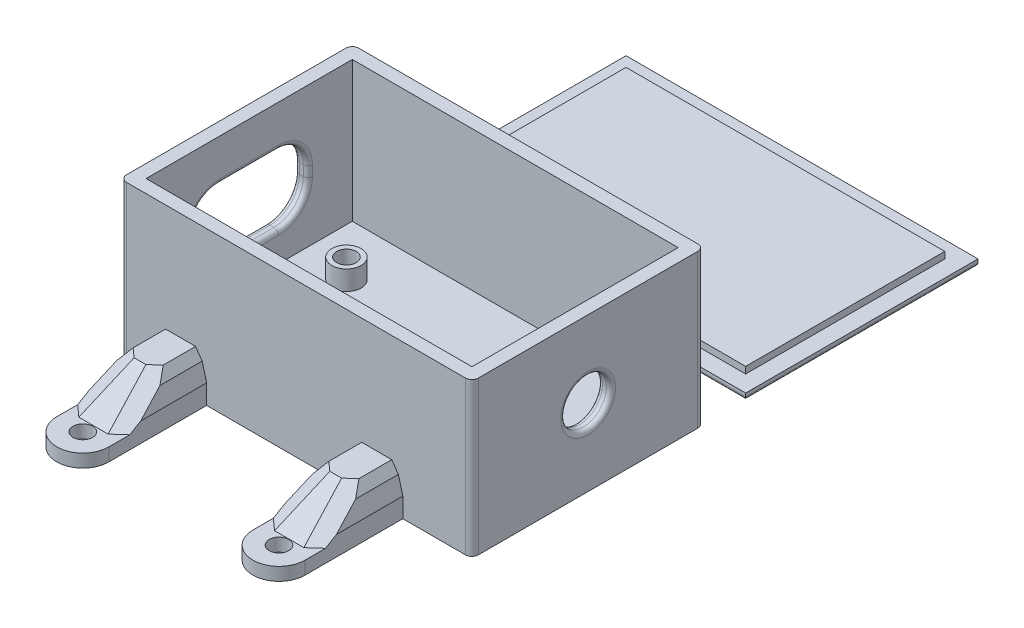
from build123d import *
from OCP.BRepFilletAPI import BRepFilletAPI_MakeChamfer

# Parameters (mm, degrees)
CROQUIS1_W              = 50
CROQUIS1_H              = 31.65
CROQUIS1_R              = 1.5
SALIENTE_EXTRUIR1_DEPTH = 2
CROQUIS2_W              = 54
CROQUIS2_H              = 35.65
CROQUIS2_W_2            = 50
CROQUIS2_H_2            = 31.65
SALIENTE_EXTRUIR2_DEPTH = 23.5
CROQUIS3_R              = 2.25
CROQUIS3_R_2            = 1.5
SALIENTE_EXTRUIR3_DEPTH = 3
CORTAR_EXTRUIR1_DEPTH   = 3
CROQUIS5_R              = 3.5
CORTAR_EXTRUIR2_DEPTH   = 3
REDONDEO2_R             = 0.7
CROQUIS6_R              = 1.5
SALIENTE_EXTRUIR4_DEPTH = 2
CROQUIS7_W              = 8
CROQUIS7_H              = 13.434758297
CROQUIS7_H_2            = 13.360050844
SALIENTE_EXTRUIR5_DEPTH = 5
CHAFL_N1_SIZE           = 4
CHAFL_N1_SIZE2          = 1.07179677
CHAFL_N2_SIZE           = 7.140740034
CHAFL_N2_SIZE_2         = 5
CHAFL_N3_SIZE           = 2
CHAFL_N3_SIZE_2         = 1.061715873
REDONDEO3_R             = 0.7
CROQUIS10_W             = 54
CROQUIS10_H             = 35.65
SALIENTE_EXTRUIR8_DEPTH = 1
CROQUIS11_W             = 49
CROQUIS11_H             = 30.65
SALIENTE_EXTRUIR9_DEPTH = 1
REDONDEO4_R             = 1
CHAFL_N4_SIZE           = 3
CHAFL_N4_SIZE_2         = 0.05
REDONDEO5_R             = 0.5
CHAFL_N6_SIZE           = 1.5
CHAFL_N6_SIZE2          = 0.62629425


# Some blends are built 0.0001 mm under size
with BuildPart() as part:
    # Croquis1 → Saliente-Extruir1 (new body)
    with BuildSketch(Plane(origin=(0, 0, 0), x_dir=(1, 0, 0), z_dir=(0, 1, 0))):
        with Locations((25, 15.825)):
            Rectangle(CROQUIS1_W, CROQUIS1_H)
        with Locations(Location((7.3, 23.45, 0), (0, 0, 270))):
            Circle(CROQUIS1_R, mode=Mode.SUBTRACT)
        with Locations(Location((37.4, 8.05, 0), (0, 0, 270))):
            Circle(CROQUIS1_R, mode=Mode.SUBTRACT)
    extrude(amount=SALIENTE_EXTRUIR1_DEPTH)

    # Croquis2 → Saliente-Extruir2 (add)
    with BuildSketch(Plane.XZ):
        with Locations((25, -15.825)):
            Rectangle(CROQUIS2_W, CROQUIS2_H)
        with Locations((25, -15.825)):
            Rectangle(CROQUIS2_W_2, CROQUIS2_H_2, mode=Mode.SUBTRACT)
    extrude(amount=-SALIENTE_EXTRUIR2_DEPTH)

    # Croquis3 → Saliente-Extruir3 (add)
    # profile 1 of 2: a face of its own
    with BuildSketch(Plane(origin=(0, 2, 0), x_dir=(1, 0, 0), z_dir=(0, 1, 0))):
        with Locations(Location((7.3, 23.45, 0), (0, 0, 90))):
            Circle(CROQUIS3_R)
        with Locations(Location((7.3, 23.45, 0), (0, 0, 270))):
            Circle(CROQUIS3_R_2, mode=Mode.SUBTRACT)
    # profile 2 of 2: a face of its own
    with BuildSketch(Plane(origin=(0, 2, 0), x_dir=(1, 0, 0), z_dir=(0, 1, 0))):
        with Locations(Location((37.4, 8.05, 0), (0, 0, 90))):
            Circle(CROQUIS3_R)
        with Locations(Location((37.4, 8.05, 0), (0, 0, 270))):
            Circle(CROQUIS3_R_2, mode=Mode.SUBTRACT)
    extrude(amount=SALIENTE_EXTRUIR3_DEPTH)

    # Croquis4 → Cortar-Extruir1 (cut)
    with BuildSketch(Plane.ZY.offset(2)):
        with BuildLine():
            Line((-20.325, 17.075), (-11.325, 17.075))
            ThreePointArc((-11.325, 17.075), (-8.143019485, 15.756980515), (-6.825, 12.575))
            Line((-6.825, 12.575), (-6.825, 11))
            ThreePointArc((-6.825, 11), (-8.143019485, 7.818019485), (-11.325, 6.5))
            Line((-11.325, 6.5), (-20.325, 6.5))
            ThreePointArc((-20.325, 6.5), (-23.506980515, 7.818019485), (-24.825, 11))
            Line((-24.825, 11), (-24.825, 12.575))
            ThreePointArc((-24.825, 12.575), (-23.506980515, 15.756980515), (-20.325, 17.075))
        make_face()
    extrude(amount=-CORTAR_EXTRUIR1_DEPTH, mode=Mode.SUBTRACT)

    # Croquis5 → Cortar-Extruir2 (cut)
    with BuildSketch(Plane(origin=(52, 0, 0), x_dir=(0, 0, -1), z_dir=(1, 0, 0))):
        with Locations((15.825, 11.75)):
            Circle(CROQUIS5_R)
    extrude(amount=-CORTAR_EXTRUIR2_DEPTH, mode=Mode.SUBTRACT)

    # Redondeo2
    redondeo2_edges = [part.edges().sort_by_distance(p)[0] for p in [
        (0, 7.818019485, -23.506980515),
        (0, 11.7875, -24.825),
        (0, 15.756980515, -23.506980515),
        (0, 17.075, -15.825),
        (0, 15.756980515, -8.143019485),
        (0, 11.7875, -6.825),
        (0, 7.818019485, -8.143019485),
        (0, 6.5, -15.825),
        (-2, 7.818019485, -23.506980515),
        (-2, 6.5, -15.825),
        (-2, 7.818019485, -8.143019485),
        (-2, 11.7875, -6.825),
        (-2, 15.756980515, -8.143019485),
        (-2, 17.075, -15.825),
        (-2, 15.756980515, -23.506980515),
        (-2, 11.7875, -24.825),
    ]]
    fillet(redondeo2_edges, radius=REDONDEO2_R)

    # Croquis6 → Saliente-Extruir4 (add)
    # profile 1 of 2: a face of its own
    with BuildSketch(Plane(origin=(0, 0, 0), x_dir=(-1, 0, 0), z_dir=(0, -1, 0))):
        with BuildLine():
            Line((-33.4, -2), (-33.4, -17))
            ThreePointArc((-33.4, -17), (-37.4, -21), (-41.4, -17))
            Line((-41.4, -17), (-41.4, -2))
            Line((-41.4, -2), (-33.4, -2))
        make_face()
        with Locations(Location((-37.4, -17, 0), (0, 0, 90))):
            Circle(CROQUIS6_R, mode=Mode.SUBTRACT)
    # profile 2 of 2: a face of its own
    with BuildSketch(Plane(origin=(0, 0, 0), x_dir=(-1, 0, 0), z_dir=(0, -1, 0))):
        with BuildLine():
            Line((-3.3, -2), (-3.3, -17))
            ThreePointArc((-3.3, -17), (-7.3, -21), (-11.3, -17))
            Line((-11.3, -17), (-11.3, -2))
            Line((-11.3, -2), (-3.3, -2))
        make_face()
        with Locations(Location((-7.3, -17, 0), (0, 0, 90))):
            Circle(CROQUIS6_R, mode=Mode.SUBTRACT)
    extrude(amount=-SALIENTE_EXTRUIR4_DEPTH)

    # Croquis7 → Saliente-Extruir5 (add)
    with BuildSketch(Plane(origin=(0, 2, 0), x_dir=(1, 0, 0), z_dir=(0, 1, 0))):
        with Locations((37.4, -8.717379149)):
            Rectangle(CROQUIS7_W, CROQUIS7_H)
        with Locations((7.3, -8.680025422)):
            Rectangle(CROQUIS7_W, CROQUIS7_H_2)
    extrude(amount=SALIENTE_EXTRUIR5_DEPTH)

    # Chaflán1: one chamfer whose edges measure the first distance from different faces: ONE call of the kernel's chamfer builder (chamfer() names one face for all edges)
    chafl_n1_edges_1 = [part.edges().sort_by_distance(p)[0] for p in [
        (33.4, 7, 8.717379148),
    ]]
    chafl_n1_side_1 = [part.faces().sort_by_distance(p)[0] for p in [
        (33.4, 3.419461736, 8.958993942),
    ]]
    chafl_n1_edges_2 = [part.edges().sort_by_distance(p)[0] for p in [
        (41.4, 7, 8.717379148),
    ]]
    chafl_n1_side_2 = [part.faces().sort_by_distance(p)[0] for p in [
        (41.4, 3.419461736, 8.958993942),
    ]]
    chafl_n1_edges_3 = [part.edges().sort_by_distance(p)[0] for p in [
        (11.3, 7, 8.680025422),
    ]]
    chafl_n1_side_3 = [part.faces().sort_by_distance(p)[0] for p in [
        (11.3, 3.415292105, 8.934149107),
    ]]
    chafl_n1_edges_4 = [part.edges().sort_by_distance(p)[0] for p in [
        (3.3, 7, 8.680025422),
    ]]
    chafl_n1_side_4 = [part.faces().sort_by_distance(p)[0] for p in [
        (3.3, 3.415292105, 8.934149107),
    ]]
    chafl_n1 = BRepFilletAPI_MakeChamfer(part.part.solid().wrapped)
    for e in chafl_n1_edges_1:
        chafl_n1.Add(CHAFL_N1_SIZE, CHAFL_N1_SIZE2, e.wrapped, chafl_n1_side_1[0].wrapped)  # the first distance lies on this face
    for e in chafl_n1_edges_2:
        chafl_n1.Add(CHAFL_N1_SIZE, CHAFL_N1_SIZE2, e.wrapped, chafl_n1_side_2[0].wrapped)  # the first distance lies on this face
    for e in chafl_n1_edges_3:
        chafl_n1.Add(CHAFL_N1_SIZE, CHAFL_N1_SIZE2, e.wrapped, chafl_n1_side_3[0].wrapped)  # the first distance lies on this face
    for e in chafl_n1_edges_4:
        chafl_n1.Add(CHAFL_N1_SIZE, CHAFL_N1_SIZE2, e.wrapped, chafl_n1_side_4[0].wrapped)  # the first distance lies on this face
    add(Compound.cast(chafl_n1.Shape()), mode=Mode.REPLACE)

    # Chaflán2
    chafl_n2_edges_1 = [part.edges().sort_by_distance(p)[0] for p in [
        (7.3, 7, 15.360050844),
    ]]
    chafl_n2_side_1 = [part.faces().sort_by_distance(p)[0] for p in [
        (7.3, 7, 15.260050844),
    ]]
    chafl_n2_edges_2 = [part.edges().sort_by_distance(p)[0] for p in [
        (37.4, 7, 15.434758297),
    ]]
    chafl_n2_side_2 = [part.faces().sort_by_distance(p)[0] for p in [
        (37.4, 7, 15.334758297),
    ]]
    chafl_n2 = BRepFilletAPI_MakeChamfer(part.part.solid().wrapped)
    for e in chafl_n2_edges_1:
        chafl_n2.Add(CHAFL_N2_SIZE - 0.0001, CHAFL_N2_SIZE_2 - 0.0001, e.wrapped, chafl_n2_side_1[0].wrapped)
    for e in chafl_n2_edges_2:
        chafl_n2.Add(CHAFL_N2_SIZE - 0.0001, CHAFL_N2_SIZE_2 - 0.0001, e.wrapped, chafl_n2_side_2[0].wrapped)
    add(Compound.cast(chafl_n2.Shape()), mode=Mode.REPLACE)  # a hair under: the kernel refuses the full size

    # Chaflán3
    # the kernel refuses this chamfer: 2, 1.061715873 mm, written as the material it takes off along each edge
    with BuildSketch(Plane(origin=(39.541038051, 9.937740445, 4.098564946), x_dir=(-0.9882635792671295, -0.07375593896843995, 0.13377279006212586), z_dir=(0.15190517787522226, -0.566917841763116, 0.8096474403253232))) as chafl_n3_piece_1_section:
        Polygon((CHAFL_N3_SIZE * 0.999866964113, CHAFL_N3_SIZE * 0.0163111641311), (-CHAFL_N3_SIZE_2 * 0.227924724336, CHAFL_N3_SIZE_2 * 0.973678756308), (0, 0), align=None)
    chafl_n3_piece_1 = extrude(amount=17.419597977, mode=Mode.PRIVATE)
    chafl_n3_piece_1 = split(chafl_n3_piece_1, bisect_by=Plane(origin=(40.297919966, 2, 11.036319087), z_dir=(0, 1, 0)), keep=Keep.TOP, mode=Mode.PRIVATE)
    add(chafl_n3_piece_1, mode=Mode.SUBTRACT)
    with BuildSketch(Plane(origin=(35.258961949, 9.937740445, 4.098564946), x_dir=(0.9882635792671295, -0.07375593896843995, 0.13377279006212586), z_dir=(-0.15190517787522226, -0.566917841763116, 0.8096474403253232))) as chafl_n3_piece_2_section:
        Polygon((CHAFL_N3_SIZE * 0.999866964113, -CHAFL_N3_SIZE * 0.0163111641311), (-CHAFL_N3_SIZE_2 * 0.227924724336, -CHAFL_N3_SIZE_2 * 0.973678756308), (0, 0), align=None)
    chafl_n3_piece_2 = extrude(amount=17.419597977, mode=Mode.PRIVATE)
    chafl_n3_piece_2 = split(chafl_n3_piece_2, bisect_by=Plane(origin=(34.502080034, 2, 11.036319122), z_dir=(0, 1, 0)), keep=Keep.TOP, mode=Mode.PRIVATE)
    add(chafl_n3_piece_2, mode=Mode.SUBTRACT)
    with BuildSketch(Plane(origin=(9.441038051, 9.937740445, 4.023857494), x_dir=(0.2645325925952416, -0.7659513941920656, -0.5859530435026945), z_dir=(0.15190517787522226, -0.566917841763116, 0.8096474403253232))) as chafl_n3_piece_3_section:
        Polygon((CHAFL_N3_SIZE_2 * 0.998358379547, -CHAFL_N3_SIZE_2 * 0.0572760546561), (-CHAFL_N3_SIZE * 0.267638518525, -CHAFL_N3_SIZE * 0.963519394409), (0, 0), align=None)
    chafl_n3_piece_3 = extrude(amount=17.419597977, mode=Mode.PRIVATE)
    chafl_n3_piece_3 = split(chafl_n3_piece_3, bisect_by=Plane(origin=(10.197993246, 2, 10.977264195), z_dir=(0, 1, 0)), keep=Keep.TOP, mode=Mode.PRIVATE)
    add(chafl_n3_piece_3, mode=Mode.SUBTRACT)
    with BuildSketch(Plane(origin=(5.158961949, 9.937740445, 4.023857494), x_dir=(-0.2645325925952419, -0.7659513941920656, -0.5859530435026947), z_dir=(-0.15190517787522234, -0.566917841763116, 0.8096474403253232))) as chafl_n3_piece_4_section:
        Polygon((CHAFL_N3_SIZE_2 * 0.998358379547, CHAFL_N3_SIZE_2 * 0.0572760546561), (-CHAFL_N3_SIZE * 0.267638518525, CHAFL_N3_SIZE * 0.963519394409), (0, 0), align=None)
    chafl_n3_piece_4 = extrude(amount=17.419597977, mode=Mode.PRIVATE)
    chafl_n3_piece_4 = split(chafl_n3_piece_4, bisect_by=Plane(origin=(4.402006753, 2, 10.977264231), z_dir=(0, 1, 0)), keep=Keep.TOP, mode=Mode.PRIVATE)
    add(chafl_n3_piece_4, mode=Mode.SUBTRACT)

    # Redondeo3
    redondeo3_edges = [part.edges().sort_by_distance(p)[0] for p in [
        (50, 11.75, -12.325),
        (52, 11.75, -12.325),
    ]]
    fillet(redondeo3_edges, radius=REDONDEO3_R)

    # Redondeo4
    redondeo4_edges = [part.edges().sort_by_distance(p)[0] for p in [
        (52, 11.75, 2),
        (52, 11.75, -33.65),
        (-2, 11.75, -33.65),
        (-2, 11.75, 2),
    ]]
    fillet(redondeo4_edges, radius=REDONDEO4_R)

    # Chaflán6: one chamfer whose edges measure the first distance from different faces: ONE call of the kernel's chamfer builder (chamfer() names one face for all edges)
    chafl_n6_edges_1 = [part.edges().sort_by_distance(p)[0] for p in [
        (34.47179677, 7, 4.242572884),
    ]]
    chafl_n6_side_1 = [part.faces().sort_by_distance(p)[0] for p in [
        (33.866398411, 4.740622568, 5.855945246),
    ]]
    chafl_n6_edges_2 = [part.edges().sort_by_distance(p)[0] for p in [
        (4.37179677, 7, 4.205219158),
    ]]
    chafl_n6_side_2 = [part.faces().sort_by_distance(p)[0] for p in [
        (3.765683901, 4.737955981, 5.820495672),
    ]]
    chafl_n6_edges_3 = [part.edges().sort_by_distance(p)[0] for p in [
        (40.32820323, 7, 4.242572884),
    ]]
    chafl_n6_side_3 = [part.faces().sort_by_distance(p)[0] for p in [
        (40.933601589, 4.740622568, 5.855945246),
    ]]
    chafl_n6_edges_4 = [part.edges().sort_by_distance(p)[0] for p in [
        (10.22820323, 7, 4.205219158),
    ]]
    chafl_n6_side_4 = [part.faces().sort_by_distance(p)[0] for p in [
        (10.834316099, 4.737955981, 5.820495672),
    ]]
    chafl_n6 = BRepFilletAPI_MakeChamfer(part.part.solid().wrapped)
    for e in chafl_n6_edges_1:
        chafl_n6.Add(CHAFL_N6_SIZE, CHAFL_N6_SIZE2, e.wrapped, chafl_n6_side_1[0].wrapped)  # the first distance lies on this face
    for e in chafl_n6_edges_2:
        chafl_n6.Add(CHAFL_N6_SIZE, CHAFL_N6_SIZE2, e.wrapped, chafl_n6_side_2[0].wrapped)  # the first distance lies on this face
    for e in chafl_n6_edges_3:
        chafl_n6.Add(CHAFL_N6_SIZE, CHAFL_N6_SIZE2, e.wrapped, chafl_n6_side_3[0].wrapped)  # the first distance lies on this face
    for e in chafl_n6_edges_4:
        chafl_n6.Add(CHAFL_N6_SIZE, CHAFL_N6_SIZE2, e.wrapped, chafl_n6_side_4[0].wrapped)  # the first distance lies on this face
    add(Compound.cast(chafl_n6.Shape()), mode=Mode.REPLACE)


with BuildPart() as body_2:
    # Croquis10 → Saliente-Extruir8 (new body)
    with BuildSketch(Plane.XZ):
        with Locations((25, -57.825)):
            Rectangle(CROQUIS10_W, CROQUIS10_H)
    extrude(amount=-SALIENTE_EXTRUIR8_DEPTH)

    # Croquis11 → Saliente-Extruir9 (add)
    with BuildSketch(Plane(origin=(0, 1, 0), x_dir=(1, 0, 0), z_dir=(0, 1, 0))):
        with Locations((25, 57.825)):
            Rectangle(CROQUIS11_W, CROQUIS11_H)
    extrude(amount=SALIENTE_EXTRUIR9_DEPTH)

    # Chaflán4
    # the kernel refuses this chamfer: 3, 0.05 mm, written as the material it takes off along each edge
    with BuildSketch(Plane(origin=(49.5, 2, -80.949959944), x_dir=(0.0006409399196931217, -0.9999997945979885, 0), z_dir=(0, 0, 1))) as chafl_n4_piece_1_section:
        Polygon((CHAFL_N4_SIZE * 0.999999794598, -CHAFL_N4_SIZE * 0.000640939919693), (-CHAFL_N4_SIZE_2 * 0.000640939919693, -CHAFL_N4_SIZE_2 * 0.999999794598), (0, 0), align=None)
    chafl_n4_piece_1 = extrude(amount=46.249919888, mode=Mode.PRIVATE)
    chafl_n4_piece_1 = split(chafl_n4_piece_1, bisect_by=Plane(origin=(49.478888889, 1, -57.825), z_dir=(0, 1, 0)), keep=Keep.TOP, mode=Mode.PRIVATE)
    add(chafl_n4_piece_1, mode=Mode.SUBTRACT)
    with BuildSketch(Plane(origin=(-7.299959944, 2, -73.15), x_dir=(0, -0.9999997945979885, -0.0006409399196908443), z_dir=(1, 0, 0))) as chafl_n4_piece_2_section:
        Polygon((CHAFL_N4_SIZE * 0.999999794598, -CHAFL_N4_SIZE * 0.000640939919691), (-CHAFL_N4_SIZE_2 * 0.000640939919691, -CHAFL_N4_SIZE_2 * 0.999999794598), (0, 0), align=None)
    chafl_n4_piece_2 = extrude(amount=64.599919888, mode=Mode.PRIVATE)
    chafl_n4_piece_2 = split(chafl_n4_piece_2, bisect_by=Plane(origin=(25, 1, -73.128888889), z_dir=(0, 1, 0)), keep=Keep.TOP, mode=Mode.PRIVATE)
    add(chafl_n4_piece_2, mode=Mode.SUBTRACT)
    with BuildSketch(Plane(origin=(57.299959944, 2, -42.5), x_dir=(0, -0.9999997945979885, 0.0006409399196931217), z_dir=(-1, 0, 0))) as chafl_n4_piece_3_section:
        Polygon((CHAFL_N4_SIZE * 0.999999794598, -CHAFL_N4_SIZE * 0.000640939919693), (-CHAFL_N4_SIZE_2 * 0.000640939919693, -CHAFL_N4_SIZE_2 * 0.999999794598), (0, 0), align=None)
    chafl_n4_piece_3 = extrude(amount=64.599919888, mode=Mode.PRIVATE)
    chafl_n4_piece_3 = split(chafl_n4_piece_3, bisect_by=Plane(origin=(25, 1, -42.521111111), z_dir=(0, 1, 0)), keep=Keep.TOP, mode=Mode.PRIVATE)
    add(chafl_n4_piece_3, mode=Mode.SUBTRACT)
    with BuildSketch(Plane(origin=(0.5, 2, -34.700040056), x_dir=(-0.0006409399196920719, -0.9999997945979885, 0), z_dir=(0, 0, -1))) as chafl_n4_piece_4_section:
        Polygon((CHAFL_N4_SIZE * 0.999999794598, -CHAFL_N4_SIZE * 0.000640939919692), (-CHAFL_N4_SIZE_2 * 0.000640939919692, -CHAFL_N4_SIZE_2 * 0.999999794598), (0, 0), align=None)
    chafl_n4_piece_4 = extrude(amount=46.249919888, mode=Mode.PRIVATE)
    chafl_n4_piece_4 = split(chafl_n4_piece_4, bisect_by=Plane(origin=(0.521111111, 1, -57.825), z_dir=(0, 1, 0)), keep=Keep.TOP, mode=Mode.PRIVATE)
    add(chafl_n4_piece_4, mode=Mode.SUBTRACT)

    # Redondeo5
    redondeo5_edges = [body_2.edges().sort_by_distance(p)[0] for p in [
        (25, 0, -40),
        (52, 0, -57.825),
        (25, 0, -75.65),
        (-2, 0, -57.825),
    ]]
    fillet(redondeo5_edges, radius=REDONDEO5_R)


solid = Compound([part.part, body_2.part])
